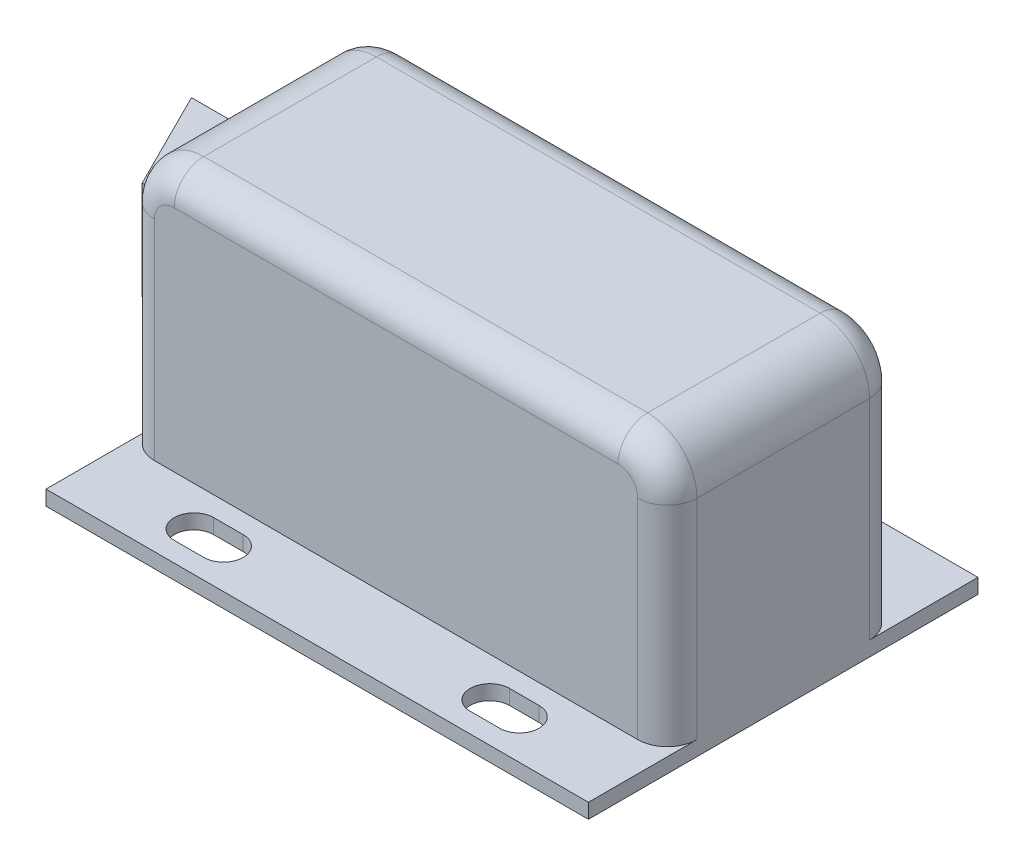
from build123d import *

# Parameters (mm, degrees)
SKETCH1_W           = 55
SKETCH1_H           = 39.5
BOSS_EXTRUDE1_DEPTH = 27.7
SKETCH2_W           = 8
SKETCH2_H           = 26.2
CUT_EXTRUDE1_DEPTH  = 65.877365082
SKETCH3_W           = 8
SKETCH3_H           = 26.2
CUT_EXTRUDE2_DEPTH  = 65.877365082
CUT_EXTRUDE3_DEPTH  = 50.345111207
CUT_EXTRUDE4_DEPTH  = 51.15765146
CUT_EXTRUDE5_DEPTH  = 50.345111207
CUT_EXTRUDE6_DEPTH  = 51.15765146
BOSS_EXTRUDE2_DEPTH = 10
FILLET1_R           = 5
FILLET2_R           = 3


with BuildPart() as part:
    # Sketch1 → Boss-Extrude1 (new body)
    with BuildSketch(Plane(origin=(0, 13.85, 0), x_dir=(1, 0, 0), z_dir=(0, 1, 0))):
        with Locations((0, -11.75)):
            Rectangle(SKETCH1_W, SKETCH1_H)
    extrude(amount=-BOSS_EXTRUDE1_DEPTH)

    # Sketch2 → Cut-Extrude1 (cut, through all)
    with BuildSketch(Plane.ZY.offset(27.5)):
        with Locations((27.5, 0.75)):
            Rectangle(SKETCH2_W, SKETCH2_H)
    extrude(amount=-CUT_EXTRUDE1_DEPTH, mode=Mode.SUBTRACT)

    # Sketch3 → Cut-Extrude2 (cut, through all)
    with BuildSketch(Plane.ZY.offset(27.5)):
        with Locations((-4, 0.75)):
            Rectangle(SKETCH3_W, SKETCH3_H)
    extrude(amount=-CUT_EXTRUDE2_DEPTH, mode=Mode.SUBTRACT)

    # Sketch4 → Cut-Extrude3 (cut, through all)
    with BuildSketch(Plane(origin=(0, -12.35, 0), x_dir=(-1, 0, 0), z_dir=(0, 1, 0))):
        with BuildLine():
            Line((-13.5, -2), (-16.5, -2))
            ThreePointArc((-16.5, -2), (-18.5, -4), (-16.5, -6))
            Line((-16.5, -6), (-13.5, -6))
            ThreePointArc((-13.5, -6), (-11.5, -4), (-13.5, -2))
        make_face()
    extrude(amount=-CUT_EXTRUDE3_DEPTH, mode=Mode.SUBTRACT)

    # Sketch5 → Cut-Extrude4 (cut, through all)
    with BuildSketch(Plane.XZ.offset(13.85)):
        with BuildLine():
            Line((-16.5, -6), (-13.5, -6))
            ThreePointArc((-13.5, -6), (-11.5, -4), (-13.5, -2))
            Line((-13.5, -2), (-16.5, -2))
            ThreePointArc((-16.5, -2), (-18.5, -4), (-16.5, -6))
        make_face()
    extrude(amount=-CUT_EXTRUDE4_DEPTH, mode=Mode.SUBTRACT)

    # Sketch6 → Cut-Extrude5 (cut, through all)
    with BuildSketch(Plane(origin=(0, -12.35, 0), x_dir=(-1, 0, 0), z_dir=(0, 1, 0))):
        with BuildLine():
            Line((16.5, 29.5), (13.5, 29.5))
            ThreePointArc((13.5, 29.5), (11.5, 27.5), (13.5, 25.5))
            Line((13.5, 25.5), (16.5, 25.5))
            ThreePointArc((16.5, 25.5), (18.5, 27.5), (16.5, 29.5))
        make_face()
    extrude(amount=-CUT_EXTRUDE5_DEPTH, mode=Mode.SUBTRACT)

    # Sketch7 → Cut-Extrude6 (cut, through all)
    with BuildSketch(Plane.XZ.offset(13.85)):
        with BuildLine():
            Line((13.5, 25.5), (16.5, 25.5))
            ThreePointArc((16.5, 25.5), (18.5, 27.5), (16.5, 29.5))
            Line((16.5, 29.5), (13.5, 29.5))
            ThreePointArc((13.5, 29.5), (11.5, 27.5), (13.5, 25.5))
        make_face()
    extrude(amount=-CUT_EXTRUDE6_DEPTH, mode=Mode.SUBTRACT)

    # Sketch8 → Boss-Extrude2 (add)
    with BuildSketch(Plane.XZ.offset(5.35)):
        Polygon((-32.5, 16.75), (-37.5, 6.75), (-27.5, 6.75), (-27.5, 16.75), align=None)
    extrude(amount=-BOSS_EXTRUDE2_DEPTH)

    # Fillet1
    fillet1_edges = [part.edges().sort_by_distance(p)[0] for p in [
        (27.5, 13.85, 11.75),
        (-27.5, 13.85, 11.75),
    ]]
    fillet(fillet1_edges, radius=FILLET1_R)

    # Fillet2
    fillet2_edges = [part.edges().sort_by_distance(p)[0] for p in [
        (27.5, -1.75, 23.5),
        (26.035533906, 12.385533906, 23.5),
        (0, 13.85, 23.5),
        (-26.035533906, 12.385533906, 23.5),
        (-27.5, -1.75, 23.5),
        (-27.5, -1.75, 0),
        (-26.035533906, 12.385533906, 0),
        (0, 13.85, 0),
        (26.035533906, 12.385533906, 0),
        (27.5, -1.75, 0),
    ]]
    fillet(fillet2_edges, radius=FILLET2_R)


solid = part.part
